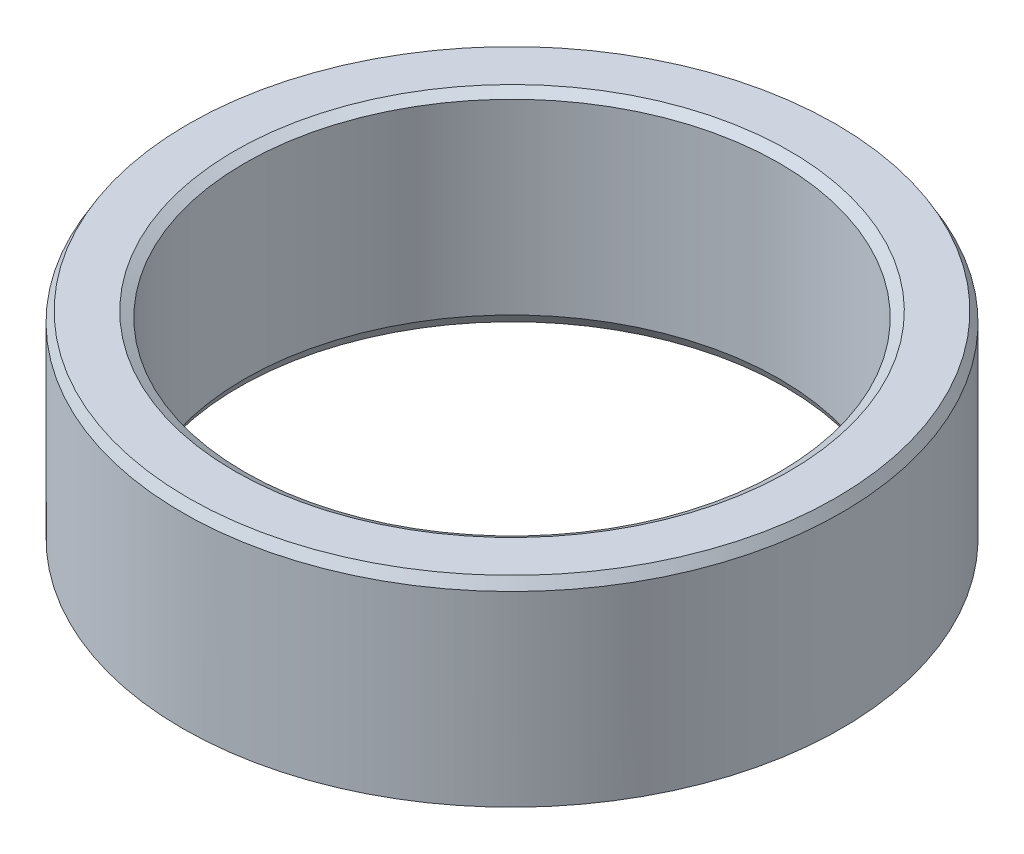
from build123d import *
from OCP.BRepFilletAPI import BRepFilletAPI_MakeChamfer

# Parameters (mm, degrees)
SKETCH1_R           = 42.5
BOSS_EXTRUDE1_DEPTH = 26.118007094
SKETCH2_R           = 34.493525537
CUT_EXTRUDE1_DEPTH  = 66.533581427
CHAMFER1_SIZE       = 1.283214508
CHAMFER1_SIZE2      = 0.740864242


with BuildPart() as part:
    # Sketch1 → Boss-Extrude1 (new body)
    with BuildSketch(Plane(origin=(0, 0, 0), x_dir=(1, 0, 0), z_dir=(0, 1, 0))):
        Circle(SKETCH1_R)
    extrude(amount=BOSS_EXTRUDE1_DEPTH)

    # Sketch2 → Cut-Extrude1 (cut, through all)
    with BuildSketch(Plane(origin=(0, 0, 0), x_dir=(1, 0, 0), z_dir=(0, 1, 0))):
        Circle(SKETCH2_R)
    extrude(amount=CUT_EXTRUDE1_DEPTH, mode=Mode.SUBTRACT)

    # Chamfer1: one chamfer whose edges measure the first distance from different faces: ONE call of the kernel's chamfer builder (chamfer() names one face for all edges)
    chamfer1_edges_1 = [part.edges().sort_by_distance(p)[0] for p in [
        (-34.493525537, 26.118007094, 0),
    ]]
    chamfer1_side_1 = [part.faces().sort_by_distance(p)[0] for p in [
        (-41.297918472, 26.118007094, 0),
    ]]
    chamfer1_edges_2 = [part.edges().sort_by_distance(p)[0] for p in [
        (-34.493525537, 0, 0),
    ]]
    chamfer1_side_2 = [part.faces().sort_by_distance(p)[0] for p in [
        (-34.493525537, 13.059003547, 0),
    ]]
    chamfer1_edges_3 = [part.edges().sort_by_distance(p)[0] for p in [
        (-42.5, 0, 0),
    ]]
    chamfer1_side_3 = [part.faces().sort_by_distance(p)[0] for p in [
        (-41.297918472, 0, 0),
    ]]
    chamfer1_edges_4 = [part.edges().sort_by_distance(p)[0] for p in [
        (-42.5, 26.118007094, 0),
    ]]
    chamfer1_side_4 = [part.faces().sort_by_distance(p)[0] for p in [
        (-42.5, 13.059003547, 0),
    ]]
    chamfer1 = BRepFilletAPI_MakeChamfer(part.part.solid().wrapped)
    for e in chamfer1_edges_1:
        chamfer1.Add(CHAMFER1_SIZE, CHAMFER1_SIZE2, e.wrapped, chamfer1_side_1[0].wrapped)  # the first distance lies on this face
    for e in chamfer1_edges_2:
        chamfer1.Add(CHAMFER1_SIZE, CHAMFER1_SIZE2, e.wrapped, chamfer1_side_2[0].wrapped)  # the first distance lies on this face
    for e in chamfer1_edges_3:
        chamfer1.Add(CHAMFER1_SIZE, CHAMFER1_SIZE2, e.wrapped, chamfer1_side_3[0].wrapped)  # the first distance lies on this face
    for e in chamfer1_edges_4:
        chamfer1.Add(CHAMFER1_SIZE, CHAMFER1_SIZE2, e.wrapped, chamfer1_side_4[0].wrapped)  # the first distance lies on this face
    add(Compound.cast(chamfer1.Shape()), mode=Mode.REPLACE)


solid = part.part
